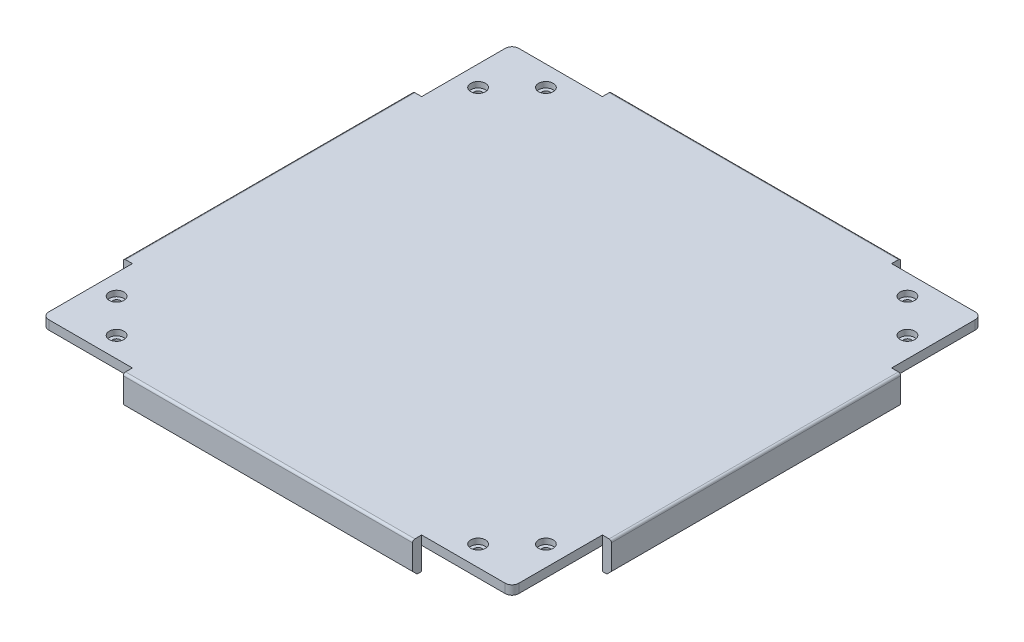
from build123d import *

# Parameters (mm, degrees)
SKETCH1_W                                     = 208
SKETCH1_H                                     = 208
BASE_PLATE_DEPTH                              = 4
MOUNTING_HOLES_START                          = 1.5
MOUNTING_HOLES_OUTLINE_R                      = 3.25
MOUNTING_HOLES_DEPTH                          = 2.5
MOUNTING_HOLES_2_OUTLINE_R                    = 1.7
MOUNTING_HOLES_2_DEPTH                        = 1.5
MOUNTING_HOLES_MIRROR2_START                  = 1.5
MOUNTING_HOLES_MIRROR2_COPY_1_SKETCH_R        = 3.25
MOUNTING_HOLES_MIRROR2_COPY_1_DEPTH           = 2.5
MOUNTING_HOLES_MIRROR2_COPY_2_SKETCH_R        = 1.7
MOUNTING_HOLES_MIRROR2_COPY_2_DEPTH           = 1.5
MOUNTING_HOLES_MIRROR2_COPY_3_SKETCH_R        = 1.7
MOUNTING_HOLES_MIRROR2_COPY_3_DEPTH           = 1.5
SKETCH5_W                                     = 128
SKETCH5_H                                     = 4
SIDE_EXTRUSION_DEPTH                          = 14
SIDE_EXTRUSION_FILLET_R                       = 1
SIDE_EXTRUSION_CHAMFER_SIZE                   = 2
SIDE_EXTRUSION_FILLET_OF_SIDE_EXTRUSION_R     = 1
SIDE_EXTRUSION_CHAMFER_OF_SIDE_EXTRUSION_SIZE = 2
SIDE_EXTRUSION_MIRROR2_START                  = -64
SIDE_EXTRUSION_MIRROR2_DEPTH                  = 128
SIDE_EXTRUSION_MIRROR2_2_DEPTH                = 128
EDGE_FILLETS_R                                = 3


# Read off the part's stored shape, not the designer's step: mounting_holes, side_extrusion_mirror2
with BuildPart() as part:
    # Sketch1 → base_plate (new body)
    with BuildSketch(Plane(origin=(0, 0, 0), x_dir=(1, 0, 0), z_dir=(0, 1, 0))):
        Rectangle(SKETCH1_W, SKETCH1_H)
    extrude(amount=BASE_PLATE_DEPTH)

    # mounting_holes outline → mounting_holes (cut)
    with BuildSketch(Plane(origin=(0, 0, 0), x_dir=(1, 0, 0), z_dir=(0, 1, 0)).offset(MOUNTING_HOLES_START)):
        with Locations((95, 80)):
            Circle(MOUNTING_HOLES_OUTLINE_R)
        with Locations((80, 95)):
            Circle(MOUNTING_HOLES_OUTLINE_R)
    mounting_holes = extrude(amount=MOUNTING_HOLES_DEPTH, mode=Mode.SUBTRACT)

    # mounting_holes 2 outline → mounting_holes 2 (cut)
    with BuildSketch(Plane(origin=(0, 0, 0), x_dir=(1, 0, 0), z_dir=(0, 1, 0))):
        with Locations((95, 80)):
            Circle(MOUNTING_HOLES_2_OUTLINE_R)
        with Locations((80, 95)):
            Circle(MOUNTING_HOLES_2_OUTLINE_R)
    mounting_holes_2 = extrude(amount=MOUNTING_HOLES_2_DEPTH, mode=Mode.SUBTRACT)

    # mounting_holes_mirror1: mounting_holes, mounting_holes 2 across plane
    add(mounting_holes.mirror(Plane.XY), mode=Mode.SUBTRACT)
    add(mounting_holes_2.mirror(Plane.XY), mode=Mode.SUBTRACT)

    # mounting_holes_mirror2: mounting_holes, mounting_holes 2 across plane
    add(mounting_holes.mirror(Plane(origin=(0, 0, 0), x_dir=(0, 0, 1), z_dir=(1, 0, 0))), mode=Mode.SUBTRACT)
    add(mounting_holes_2.mirror(Plane(origin=(0, 0, 0), x_dir=(0, 0, 1), z_dir=(1, 0, 0))), mode=Mode.SUBTRACT)

    # mounting_holes_mirror2 copy 1 sketch → mounting_holes_mirror2 copy 1 (cut)
    with BuildSketch(Plane(origin=(0, 0, 0), x_dir=(-1, 0, 0), z_dir=(0, 1, 0)).offset(MOUNTING_HOLES_MIRROR2_START)):
        with Locations((95, 80)):
            Circle(MOUNTING_HOLES_MIRROR2_COPY_1_SKETCH_R)
        with Locations((80, 95)):
            Circle(MOUNTING_HOLES_MIRROR2_COPY_1_SKETCH_R)
    extrude(amount=MOUNTING_HOLES_MIRROR2_COPY_1_DEPTH, mode=Mode.SUBTRACT)

    # mounting_holes_mirror2 copy 2 sketch → mounting_holes_mirror2 copy 2 (cut)
    with BuildSketch(Plane(origin=(0, 0, 0), x_dir=(-1, 0, 0), z_dir=(0, 1, 0))):
        with Locations((95, 80)):
            Circle(MOUNTING_HOLES_MIRROR2_COPY_2_SKETCH_R)
        with Locations((80, 95)):
            Circle(MOUNTING_HOLES_MIRROR2_COPY_2_SKETCH_R)
    extrude(amount=MOUNTING_HOLES_MIRROR2_COPY_2_DEPTH, mode=Mode.SUBTRACT)

    # mounting_holes_mirror2 copy 3 sketch → mounting_holes_mirror2 copy 3 (cut)
    with BuildSketch(Plane(origin=(0, 0, 0), x_dir=(-1, 0, 0), z_dir=(0, 1, 0))):
        with Locations((95, -80)):
            Circle(MOUNTING_HOLES_MIRROR2_COPY_3_SKETCH_R)
        with Locations((80, -95)):
            Circle(MOUNTING_HOLES_MIRROR2_COPY_3_SKETCH_R)
    extrude(amount=MOUNTING_HOLES_MIRROR2_COPY_3_DEPTH, mode=Mode.SUBTRACT)

    # Sketch5 → side_extrusion (add)
    with BuildSketch(Plane(origin=(0, 4, 0), x_dir=(1, 0, 0), z_dir=(0, 1, 0))):
        with Locations((0, 106)):
            Rectangle(SKETCH5_W, SKETCH5_H)
    side_extrusion = extrude(amount=-SIDE_EXTRUSION_DEPTH)

    # side_extrusion_fillet
    side_extrusion_fillet_edges = [part.edges().sort_by_distance(p)[0] for p in [
        (0, 4, -108),
    ]]
    fillet(side_extrusion_fillet_edges, radius=SIDE_EXTRUSION_FILLET_R)

    # side_extrusion_chamfer
    side_extrusion_chamfer_edges = [part.edges().sort_by_distance(p)[0] for p in [
        (0, -10, -108),
    ]]
    chamfer(side_extrusion_chamfer_edges, length=SIDE_EXTRUSION_CHAMFER_SIZE)

    # side_extrusion_mirror1: side_extrusion across plane
    add(side_extrusion.mirror(Plane(origin=(0, 0, 0), x_dir=(0.7071067811865476, 0, 0.7071067811865476), z_dir=(0.7071067811865477, 0, -0.7071067811865475))))

    # side_extrusion_fillet of side_extrusion
    side_extrusion_fillet_of_side_extrusion_edges = [part.edges().sort_by_distance(p)[0] for p in [
        (-108, 4, 0),
    ]]
    fillet(side_extrusion_fillet_of_side_extrusion_edges, radius=SIDE_EXTRUSION_FILLET_OF_SIDE_EXTRUSION_R)

    # side_extrusion_chamfer of side_extrusion
    side_extrusion_chamfer_of_side_extrusion_edges = [part.edges().sort_by_distance(p)[0] for p in [
        (-108, -10, 0),
    ]]
    chamfer(side_extrusion_chamfer_of_side_extrusion_edges, length=SIDE_EXTRUSION_CHAMFER_OF_SIDE_EXTRUSION_SIZE)

    # side_extrusion_mirror2 outline → side_extrusion_mirror2 (add)
    with BuildSketch(Plane.YZ.offset(SIDE_EXTRUSION_MIRROR2_START)):
        with BuildLine():
            Line((-8, 108), (-10, 106))
            Line((-10, 106), (-10, 104))
            Line((-10, 104), (4, 104))
            Line((4, 104), (4, 107))
            ThreePointArc((4, 107), (3.707106781, 107.707106781), (3, 108))
            Line((3, 108), (-8, 108))
        make_face()
    extrude(amount=SIDE_EXTRUSION_MIRROR2_DEPTH)

    # side_extrusion_mirror2 2 outline → side_extrusion_mirror2 2 (add)
    with BuildSketch(Plane.XY.offset(SIDE_EXTRUSION_MIRROR2_START)):
        with BuildLine():
            Line((104, 4), (104, -10))
            Line((104, -10), (106, -10))
            Line((106, -10), (108, -8))
            Line((108, -8), (108, 3))
            ThreePointArc((108, 3), (107.707106781, 3.707106781), (107, 4))
            Line((107, 4), (104, 4))
        make_face()
    extrude(amount=SIDE_EXTRUSION_MIRROR2_2_DEPTH)

    # edge_fillets
    edge_fillets_edges = [part.edges().sort_by_distance(p)[0] for p in [
        (104, 2, 104),
        (-104, 2, 104),
        (-104, 2, -104),
        (104, 2, -104),
    ]]
    fillet(edge_fillets_edges, radius=EDGE_FILLETS_R)


solid = part.part
